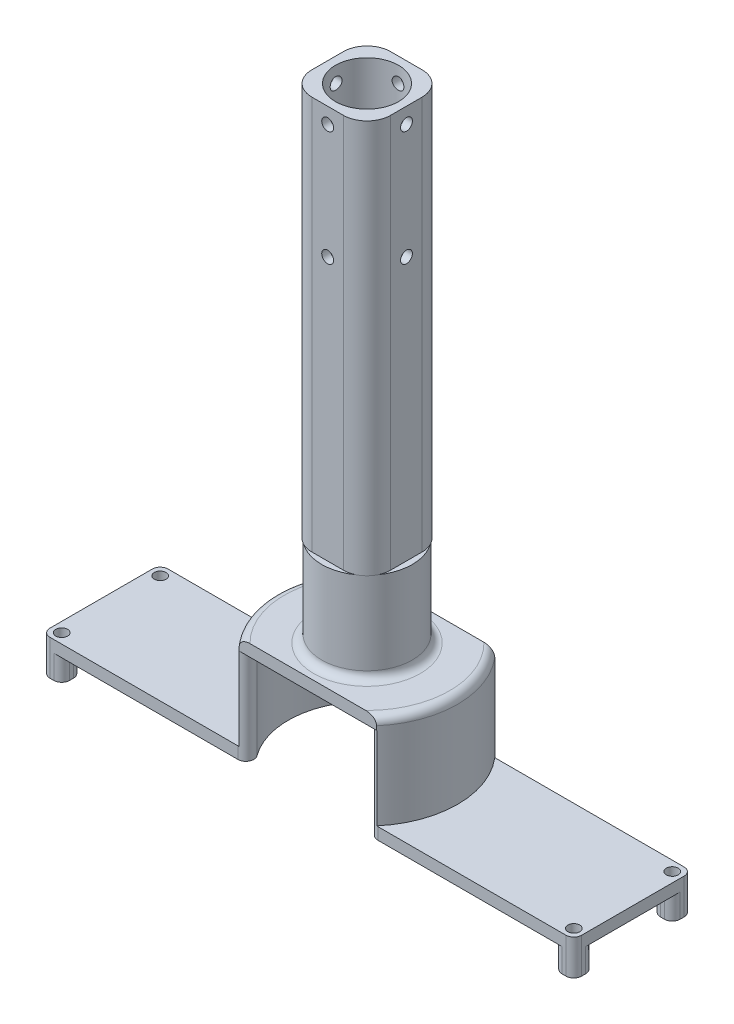
from build123d import *
from build123d.topology import SkipClean

# Parameters (mm, degrees)
SKETCH_1_R          = 1.5
EXTRUDE_1_DEPTH     = 3
EXTRUDE_1_2_DEPTH   = 3
EXTRUDE_START       = 6
SKETCH_2_W          = 5
SKETCH_2_H          = 5
SKETCH_2_R          = 1.5
EXTRUDE_2_DEPTH     = 6
EXTRUDE_3_DEPTH     = 21
SKETCH_4_R          = 9.192388155
EXTRUDE_4_DEPTH     = 3
SKETCH_6_R          = 11.5
SKETCH_6_R_2        = 9.5
EXTRUDE_6_DEPTH     = 23
SKETCH_7_W          = 20
SKETCH_7_H          = 20
SKETCH_7_R          = 8
EXTRUDE_7_DEPTH     = 100
FILLET_1_R          = 6
SKETCH_8_R          = 1.5
CUT_EXTRUDE_1_DEPTH = 100
SKETCH_9_R          = 1.5
CUT_EXTRUDE_2_DEPTH = 100
FILLET_3_R          = 2
FILLET_4_R          = 2
FILLET_5_R          = 2
FILLET_6_R          = 2


with BuildPart() as part:
    # 草图1 → 凸台-拉伸1 (new body)
    with BuildSketch(Plane(origin=(0, 0, 0), x_dir=(1, 0, 0), z_dir=(0, 1, 0))):
        with BuildLine():
            Line((-35.753469741, 40.751225721), (-90.024713186, 40.751225721))
            Line((-90.024713186, 40.751225721), (-90.024713186, 10.751225721))
            Line((-90.024713186, 10.751225721), (-35.753469741, 10.751225721))
            ThreePointArc((-35.753469741, 10.751225721), (-42.524713186, 25.751225721), (-35.753469741, 40.751225721))
        make_face()
        with Locations(Location((-87.524713186, 13.251225721, 0), (0, 0, 270))):
            Circle(SKETCH_1_R, mode=Mode.SUBTRACT)
        with Locations(Location((-87.524713186, 38.251225721, 0), (0, 0, 270))):
            Circle(SKETCH_1_R, mode=Mode.SUBTRACT)
    extrude(amount=EXTRUDE_1_DEPTH)



with BuildPart() as body_2:
    # 草图1 → Extrude 1 2 (new body)
    with BuildSketch(Plane(origin=(0, 0, 0), x_dir=(1, 0, 0), z_dir=(0, 1, 0))):
        with BuildLine():
            Line((44.975286814, 40.751225721), (-9.29595663, 40.751225721))
            ThreePointArc((-9.29595663, 40.751225721), (-4.29595663, 33.979982276), (-2.524713186, 25.751225721))
            ThreePointArc((-2.524713186, 25.751225721), (-4.29595663, 17.522469165), (-9.29595663, 10.751225721))
            Line((-9.29595663, 10.751225721), (44.975286814, 10.751225721))
            Line((44.975286814, 10.751225721), (44.975286814, 40.751225721))
        make_face()
        with Locations(Location((42.475286814, 13.251225721, 0), (0, 0, 270))):
            Circle(SKETCH_1_R, mode=Mode.SUBTRACT)
        with Locations(Location((42.475286814, 38.251225721, 0), (0, 0, 270))):
            Circle(SKETCH_1_R, mode=Mode.SUBTRACT)
    extrude(amount=EXTRUDE_1_2_DEPTH)


with BuildPart() as part_1:
    with SkipClean():  # the faces are left unmerged after this step: merging them gives an invalid solid
        add(part.part)

        add(body_2.part)  # 凸台-拉伸2 merges body 2
        # 草图2 → 凸台-拉伸2 (add)
        # profile 1 of 4: a face of its own
        with BuildSketch(Plane.XZ.offset(EXTRUDE_START)):
            with Locations((-87.524713186, -13.251225721)):
                Rectangle(SKETCH_2_W, SKETCH_2_H)
            with Locations(Location((-87.524713186, -13.251225721, 0), (0, 0, 270))):
                Circle(SKETCH_2_R, mode=Mode.SUBTRACT)
        # profile 2 of 4: a face of its own
        with BuildSketch(Plane.XZ.offset(EXTRUDE_START)):
            with Locations((42.475286814, -13.251225721)):
                Rectangle(SKETCH_2_W, SKETCH_2_H)
            with Locations(Location((42.475286814, -13.251225721, 0), (0, 0, 270))):
                Circle(SKETCH_2_R, mode=Mode.SUBTRACT)
        # profile 3 of 4: a face of its own
        with BuildSketch(Plane.XZ.offset(EXTRUDE_START)):
            with Locations((42.475286814, -38.251225721)):
                Rectangle(SKETCH_2_W, SKETCH_2_H)
            with Locations(Location((42.475286814, -38.251225721, 0), (0, 0, 270))):
                Circle(SKETCH_2_R, mode=Mode.SUBTRACT)
        # profile 4 of 4: a face of its own
        with BuildSketch(Plane.XZ.offset(EXTRUDE_START)):
            with Locations((-87.524713186, -38.251225721)):
                Rectangle(SKETCH_2_W, SKETCH_2_H)
            with Locations(Location((-87.524713186, -38.251225721, 0), (0, 0, 270))):
                Circle(SKETCH_2_R, mode=Mode.SUBTRACT)
        extrude(amount=-EXTRUDE_2_DEPTH)

    # 草图3 → 凸台-拉伸3 (add)
    with SkipClean():  # the faces are left unmerged after this step: merging them gives an invalid solid
        with BuildSketch(Plane(origin=(0, 3, 0), x_dir=(1, 0, 0), z_dir=(0, 1, 0))):
            with BuildLine():
                Line((-39.96030896, 40.751225721), (-35.753469741, 40.751225721))
                ThreePointArc((-35.753469741, 40.751225721), (-42.524713186, 25.751225721), (-35.753469741, 10.751225721))
                Line((-35.753469741, 10.751225721), (-39.96030896, 10.751225721))
                ThreePointArc((-39.96030896, 10.751225721), (-45.524713186, 25.751225721), (-39.96030896, 40.751225721))
            make_face()
            with BuildLine():
                Line((-5.089117412, 40.751225721), (-9.29595663, 40.751225721))
                ThreePointArc((-9.29595663, 40.751225721), (-2.524713186, 25.751225721), (-9.29595663, 10.751225721))
                Line((-9.29595663, 10.751225721), (-5.089117412, 10.751225721))
                ThreePointArc((-5.089117412, 10.751225721), (0.475286814, 25.751225721), (-5.089117412, 40.751225721))
            make_face()
        extrude(amount=EXTRUDE_3_DEPTH)

    # 草图4 → 凸台-拉伸4 (add)
    with SkipClean():  # the faces are left unmerged after this step: merging them gives an invalid solid
        with BuildSketch(Plane(origin=(0, 24, 0), x_dir=(1, 0, 0), z_dir=(0, 1, 0))):
            with BuildLine():
                Line((-39.96030896, 40.751225721), (-5.089117412, 40.751225721))
                ThreePointArc((-5.089117412, 40.751225721), (0.475286814, 25.751225721), (-5.089117412, 10.751225721))
                Line((-5.089117412, 10.751225721), (-39.96030896, 10.751225721))
                ThreePointArc((-39.96030896, 10.751225721), (-45.524713186, 25.751225721), (-39.96030896, 40.751225721))
            make_face()
            with Locations(Location((-22.524713186, 25.751225721, 0), (0, 0, 270))):
                Circle(SKETCH_4_R, mode=Mode.SUBTRACT)
        extrude(amount=EXTRUDE_4_DEPTH)

    # 草图6 → 凸台-拉伸6 (add)
    with SkipClean():  # the faces are left unmerged after this step: merging them gives an invalid solid
        with BuildSketch(Plane(origin=(0, 27, 0), x_dir=(1, 0, 0), z_dir=(0, 1, 0))):
            with Locations(Location((-22.524713186, 25.751225721, 0), (0, 0, 270))):
                Circle(SKETCH_6_R)
            with Locations(Location((-22.524713186, 25.751225721, 0), (0, 0, 270))):
                Circle(SKETCH_6_R_2, mode=Mode.SUBTRACT)
        extrude(amount=EXTRUDE_6_DEPTH)

    # 草图7 → 凸台-拉伸7 (add)
    with SkipClean():  # the faces are left unmerged after this step: merging them gives an invalid solid
        with BuildSketch(Plane(origin=(0, 50, 0), x_dir=(1, 0, 0), z_dir=(0, 1, 0))):
            with Locations((-22.524713186, 25.751225721)):
                Rectangle(SKETCH_7_W, SKETCH_7_H)
            with Locations(Location((-22.524713186, 25.751225721, 0), (0, 0, 270))):
                Circle(SKETCH_7_R, mode=Mode.SUBTRACT)
        extrude(amount=EXTRUDE_7_DEPTH)

    # 圆角1
    # the kernel refuses this fillet: 6 mm, written as the material it takes off along each edge
    with BuildSketch(Plane(origin=(-32.524713186, 50, -35.751225721), x_dir=(0, 0, 1), z_dir=(0, 1, 0)), Plane(origin=(-32.524713186, 50, -15.751225721), x_dir=(1, 0, 0), z_dir=(0, 1, 0)), Plane(origin=(-12.524713186, 50, -35.751225721), x_dir=(-1, 0, 0), z_dir=(0, 1, 0))) as fillet_1_piece_1:
        with BuildLine():
            CenterArc((FILLET_1_R, FILLET_1_R), FILLET_1_R, 180, 90)
            Line((0, FILLET_1_R), (0, 0))
            Line((0, 0), (FILLET_1_R, 0))
        make_face()
    extrude(amount=115, mode=Mode.SUBTRACT)
    with BuildSketch(Plane(origin=(-12.524713186, 50, -15.751225721), x_dir=(-1, 0, 0), z_dir=(0, 1, 0))) as fillet_1_piece_2:
        with BuildLine():
            CenterArc((FILLET_1_R, -FILLET_1_R), FILLET_1_R, 90, 90)
            Line((0, -FILLET_1_R), (0, 0))
            Line((0, 0), (FILLET_1_R, 0))
        make_face()
    extrude(amount=115, mode=Mode.SUBTRACT)

    # 草图8 → 切除-拉伸1 (cut)
    with BuildSketch(Plane.XY.offset(-15.751225721)):
        with Locations((-22.516225834, 146)):
            Circle(SKETCH_8_R)
        with Locations((-22.516225834, 116.86)):
            Circle(SKETCH_8_R)
    extrude(amount=-CUT_EXTRUDE_1_DEPTH, mode=Mode.SUBTRACT)

    # 草图9 → 切除-拉伸2 (cut)
    with BuildSketch(Plane(origin=(-12.524713186, 0, 0), x_dir=(0, 0, -1), z_dir=(1, 0, 0))):
        with Locations((25.773443846, 146)):
            Circle(SKETCH_9_R)
        with Locations((25.773443846, 116.86)):
            Circle(SKETCH_9_R)
    extrude(amount=-CUT_EXTRUDE_2_DEPTH, mode=Mode.SUBTRACT)

    # 圆角3
    fillet_3_edges = [part_1.edges().sort_by_distance(p)[0] for p in [
        (-22.524713186, 27, -37.251225721),
        (-22.524713186, 24, -34.943613876),
        (-45.524713186, 27, -25.751225721),
        (0.475286814, 27, -25.751225721),
    ]]
    fillet(fillet_3_edges, radius=FILLET_3_R)

    # 圆角4
    fillet_4_edges = [part_1.edges().sort_by_distance(p)[0] for p in [
        (-90.024713186, -1.5, -10.751225721),
        (-90.024713186, -1.5, -40.751225721),
        (-90.024713186, -3, -15.751225721),
        (-85.024713186, -3, -15.751225721),
        (-85.024713186, -3, -10.751225721),
        (-90.024713186, -3, -35.751225721),
        (-85.024713186, -3, -40.751225721),
        (-85.024713186, -3, -35.751225721),
        (44.975286814, -1.5, -10.751225721),
        (44.975286814, -3, -15.751225721),
        (44.975286814, -1.5, -40.751225721),
        (39.975286814, -3, -40.751225721),
        (39.975286814, -3, -10.751225721),
        (39.975286814, -3, -15.751225721),
        (44.975286814, -3, -35.751225721),
        (39.975286814, -3, -35.751225721),
    ]]
    fillet(fillet_4_edges, radius=FILLET_4_R)

    # 圆角5
    # the kernel refuses this fillet: 2 mm, written as the material it takes off along each edge
    with BuildSketch(Plane(origin=(-35.753469741, -11.298706985, -10.751225721), x_dir=(-1, 0, 0), z_dir=(0, 1, 0)), Plane(origin=(-9.29595663, 24, -10.751225721), x_dir=(1, 0, 0), z_dir=(0, -1, 0))) as fillet_5_piece_1:
        with BuildLine():
            CenterArc((4.519482794, -2), FILLET_5_R, 90, 126.22154662)
            ThreePointArc((2.906006489, -3.181818182), (1.538946806, -1.512415434), (0, 0))
            Line((0, 0), (4.519482794, 0))
        make_face()
    extrude(amount=35.298706985, mode=Mode.SUBTRACT)
    with BuildSketch(Plane(origin=(-35.753469741, -11.298706985, -40.751225721), x_dir=(-1, 0, 0), z_dir=(0, 1, 0)), Plane(origin=(-9.29595663, 24, -40.751225721), x_dir=(1, 0, 0), z_dir=(0, -1, 0))) as fillet_5_piece_2:
        with BuildLine():
            CenterArc((4.519482794, 2), FILLET_5_R, 143.77845338, 126.22154662)
            ThreePointArc((2.906006489, 3.181818182), (1.538946806, 1.512415434), (0, 0))
            Line((0, 0), (4.519482794, 0))
        make_face()
    extrude(amount=35.298706985, mode=Mode.SUBTRACT)

    # 圆角6
    # the kernel refuses this fillet: 2 mm, written as the material it takes off along each edge
    with BuildSketch(Plane(origin=(-22.524713186, 50, -25.751225721), x_dir=(0, 0, 1), z_dir=(-1, 0, 0))) as fillet_6_piece_1:
        with BuildLine():
            CenterArc((10, 1.936491673), FILLET_6_R, 180, 75.522487814)
            Line((8, 1.936491673), (7.96, 1.936491673))
            Line((7.96, 1.936491673), (7.96, 0))
            Line((7.96, 0), (8, -0.04))
            ThreePointArc((8, -0.04), (8.75, -0.04), (9.49, -0.038729833))
            Line((9.49, -0.038729833), (9.5, 0))
        make_face()
    revolve(axis=Axis((-22.524713186, 50, -25.751225721), (0, 1, 0)), mode=Mode.SUBTRACT)


solid = part_1.part
